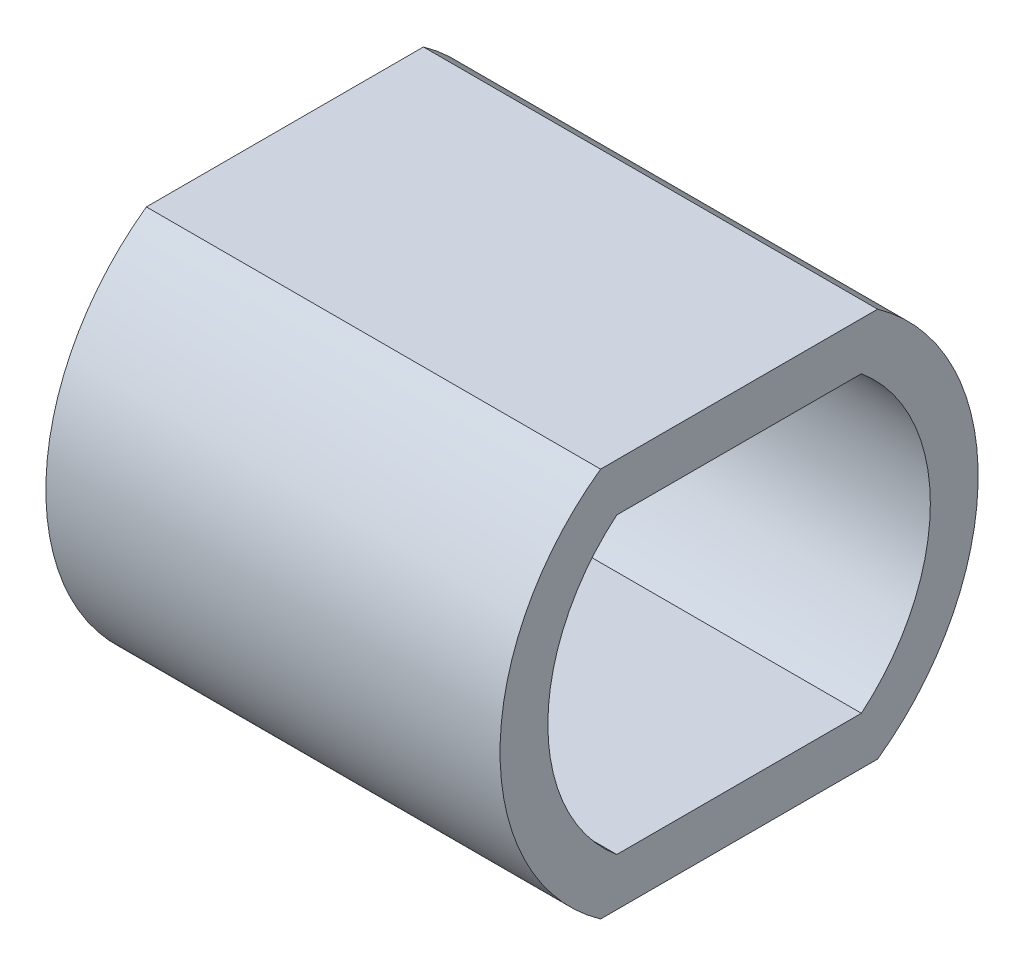
from build123d import *

# Parameters (mm, degrees)
SKETCH_1_W        = 0.8
SKETCH_1_H        = 2.6
SKETCH_1_R        = 4.5
EXTRUDE_1_DEPTH   = 2
EXTRUDE_START     = -4
EXTRUDE_1_2_DEPTH = 19


# Read off the part's stored shape, not the designer's step: 拉伸-薄壁1
with BuildPart() as part:
    # 草图1 → Extrude 1 (new body)
    with BuildSketch(Plane(origin=(0, 0, 0), x_dir=(0, 0, -1), z_dir=(1, 0, 0))):
        with BuildLine():
            ThreePointArc((-5.116395215, 6.15), (-8, 0), (-5.116395215, -6.15))
            Line((-5.116395215, -6.15), (5.116395215, -6.15))
            ThreePointArc((5.116395215, -6.15), (7.243312837, -3.396236025), (8, 0))
            ThreePointArc((8, 0), (7.243312837, 3.396236025), (5.116395215, 6.15))
            Line((5.116395215, 6.15), (-5.116395215, 6.15))
        make_face()
        with Locations((-6.1, 0)):
            Rectangle(SKETCH_1_W, SKETCH_1_H, mode=Mode.SUBTRACT)
        Circle(SKETCH_1_R, mode=Mode.SUBTRACT)
        with Locations((6.1, 0)):
            Rectangle(SKETCH_1_W, SKETCH_1_H, mode=Mode.SUBTRACT)
    extrude(amount=-EXTRUDE_1_DEPTH)

    # Extrude 1 2 outline → Extrude 1 2 (add)
    with BuildSketch(Plane(origin=(0, 0, 0), x_dir=(0, 0, -1), z_dir=(1, 0, 0)).offset(EXTRUDE_START)):
        with BuildLine():
            Line((5.794609564, 8.15), (-5.794609564, 8.15))
            ThreePointArc((-5.794609564, 8.15), (-10, 0), (-5.794609564, -8.15))
            Line((-5.794609564, -8.15), (5.794609564, -8.15))
            ThreePointArc((5.794609564, -8.15), (10, 0), (5.794609564, 8.15))
        make_face()
        with BuildLine():
            ThreePointArc((-5.116395215, -6.15), (-8, 0), (-5.116395215, 6.15))
            Line((-5.116395215, 6.15), (5.116395215, 6.15))
            ThreePointArc((5.116395215, 6.15), (8, 0), (5.116395215, -6.15))
            Line((5.116395215, -6.15), (-5.116395215, -6.15))
        make_face(mode=Mode.SUBTRACT)
    extrude(amount=EXTRUDE_1_2_DEPTH)


solid = part.part
